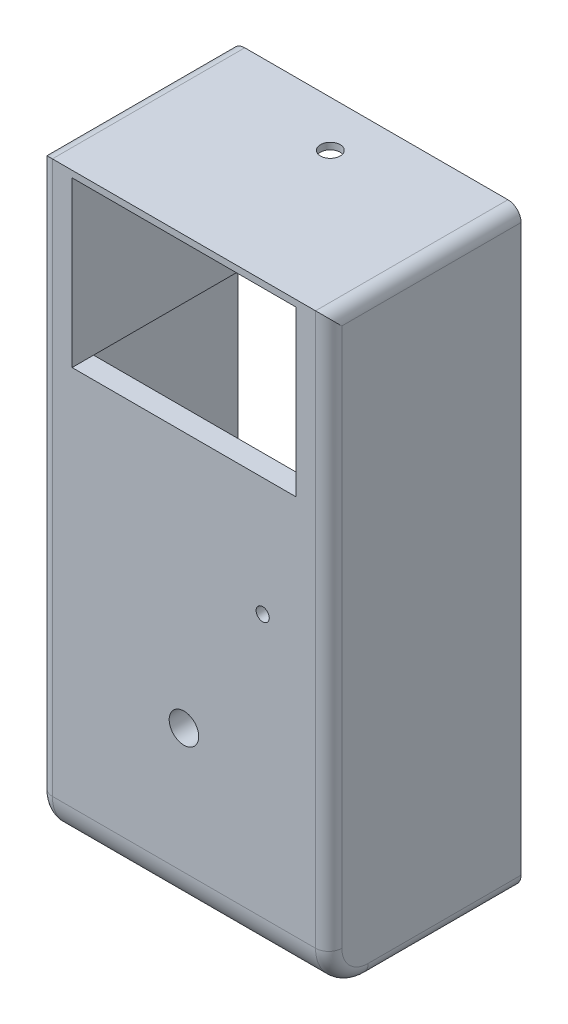
from build123d import *

# Parameters (mm, degrees)
SKETCH_1_W               = 340.4
SKETCH_1_H               = 900
EXTRUDE_1_DEPTH          = 292.7
SKETCH_2_R               = 22.5
CUT_EXTRUDE_1_DEPTH      = 1006.756158321
SKETCH_3_W               = 50
SKETCH_3_H               = 900
EXTRUDE_2_DEPTH          = 292.7
FILLET_9_R               = 20
FILLET_10_R              = 60
CUT_EXTRUDE_3_DEPTH      = 1024.760445612
CUT_EXTRUDE_3_DEPTH_BACK = 1024.760445612
SKETCH_5_R               = 10
CUT_EXTRUDE_4_REACH      = 1025.76
CUT_EXTRUDE_4_END_RADIUS = 22.5
SKETCH_6_R               = 15
SKETCH_7_W               = 420.4
SKETCH_7_H               = 630
CUT_EXTRUDE_6_DEPTH      = 260
CUT_EXTRUDE_7_DEPTH      = 1024.760445612


with BuildPart() as part:
    # 草图1 → 凸台-拉伸1 (new body)
    with BuildSketch(Plane.XY):
        with Locations((170.2, -450)):
            Rectangle(SKETCH_1_W, SKETCH_1_H)
    extrude(amount=EXTRUDE_1_DEPTH)

    # 草图2 → 切除-拉伸1 (cut, through all)
    with BuildSketch(Plane.XY.offset(292.7)):
        with Locations((170.2, -650)):
            Circle(SKETCH_2_R)
    extrude(amount=-CUT_EXTRUDE_1_DEPTH, mode=Mode.SUBTRACT)

    # 草图3 → 凸台-拉伸2 (add)
    with BuildSketch(Plane(origin=(0, 0, 0), x_dir=(-1, 0, 0), z_dir=(0, 0, -1))):
        with Locations((-365.4, -450)):
            Rectangle(SKETCH_3_W, SKETCH_3_H)
        with Locations((25, -450)):
            Rectangle(SKETCH_3_W, SKETCH_3_H)
    extrude(amount=-EXTRUDE_2_DEPTH)

    # 圆角9
    fillet_9_edges = [part.edges().sort_by_distance(p)[0] for p in [
        (390.4, -450, 292.7),
        (390.4, -900, 146.35),
        (390.4, 0, 146.35),
        (-50, -450, 292.7),
        (-50, 0, 146.35),
        (-50, -900, 146.35),
    ]]
    fillet(fillet_9_edges, radius=FILLET_9_R)

    # 圆角10
    # the kernel refuses this fillet: 60 mm, written as the material it takes off along each edge
    with BuildSketch(Plane(origin=(390.4, -840, 232.7), x_dir=(0, 0, 1), z_dir=(0, 1, 0))) as fillet_10_piece_1:
        with BuildLine():
            CenterArc((40, -20), 20, 0, 90)
            Line((60, -20), (60, 0))
            Line((60, 0), (40, 0))
        make_face()
    revolve(axis=Axis((390.4, -840, 232.7), (1, 0, 0)), revolution_arc=90, mode=Mode.SUBTRACT)
    with BuildSketch(Plane(origin=(-50, -840, 232.7), x_dir=(0, -1, 0), z_dir=(0, 0, -1))) as fillet_10_piece_2:
        with BuildLine():
            CenterArc((40, -20), 20, 0, 90)
            Line((60, -20), (60, 0))
            Line((60, 0), (40, 0))
        make_face()
    revolve(axis=Axis((-50, -840, 232.7), (-1, 0, 0)), revolution_arc=90, mode=Mode.SUBTRACT)
    with BuildSketch(Plane(origin=(-50, -900, 292.7), x_dir=(0, 1, 0), z_dir=(1, 0, 0))) as fillet_10_piece_3:
        with BuildLine():
            CenterArc((FILLET_10_R, -FILLET_10_R), FILLET_10_R, 90, 90)
            Line((0, -FILLET_10_R), (0, 0))
            Line((0, 0), (FILLET_10_R, 0))
        make_face()
    extrude(amount=440.4, mode=Mode.SUBTRACT)

    # 草图5 → 切除-拉伸3 (cut, two sides: drawn at the far end of the back side and taken through both)
    with BuildSketch(Plane.XY.offset(292.7).offset(-CUT_EXTRUDE_3_DEPTH_BACK)):
        with Locations((290, -440)):
            Circle(SKETCH_5_R)
    extrude(amount=CUT_EXTRUDE_3_DEPTH + CUT_EXTRUDE_3_DEPTH_BACK, mode=Mode.SUBTRACT)

    # 切除-拉伸4: up to this cylinder (the profile starts outside it)
    cut_extrude_4_end = Plane(origin=(170.2, -650, 70), z_dir=(0, 0, 1)) * Cylinder(CUT_EXTRUDE_4_END_RADIUS, 2097.52, mode=Mode.PRIVATE)
    # 草图6 → 切除-拉伸4 (cut, up to the surface)
    with BuildSketch(Plane(origin=(0, 0, 0), x_dir=(1, 0, 0), z_dir=(0, 1, 0)), mode=Mode.PRIVATE) as cut_extrude_4_sk1:
        with Locations(Location((170.2, -70, 0), (0, 0, 270))):
            Circle(SKETCH_6_R)
    cut_extrude_4_tool1 = extrude(cut_extrude_4_sk1.sketch, amount=-CUT_EXTRUDE_4_REACH, mode=Mode.PRIVATE) - cut_extrude_4_end
    add(cut_extrude_4_tool1.solids().sort_by_distance((170.2, 0, 70))[0], mode=Mode.SUBTRACT)

    # 草图7 → 切除-拉伸6 (cut)
    with BuildSketch(Plane(origin=(0, 0, 0), x_dir=(-1, 0, 0), z_dir=(0, 0, -1))):
        with Locations((-170.2, -575)):
            Rectangle(SKETCH_7_W, SKETCH_7_H)
    extrude(amount=-CUT_EXTRUDE_6_DEPTH, mode=Mode.SUBTRACT)

    # 草图8 → 切除-拉伸7 (cut, through all)
    with BuildSketch(Plane.XY.offset(292.7)):
        Polygon((170.2, -10), (0, -10), (0, -260), (340.4, -260), (340.4, -10), align=None)
    extrude(amount=-CUT_EXTRUDE_7_DEPTH, mode=Mode.SUBTRACT)


solid = part.part
